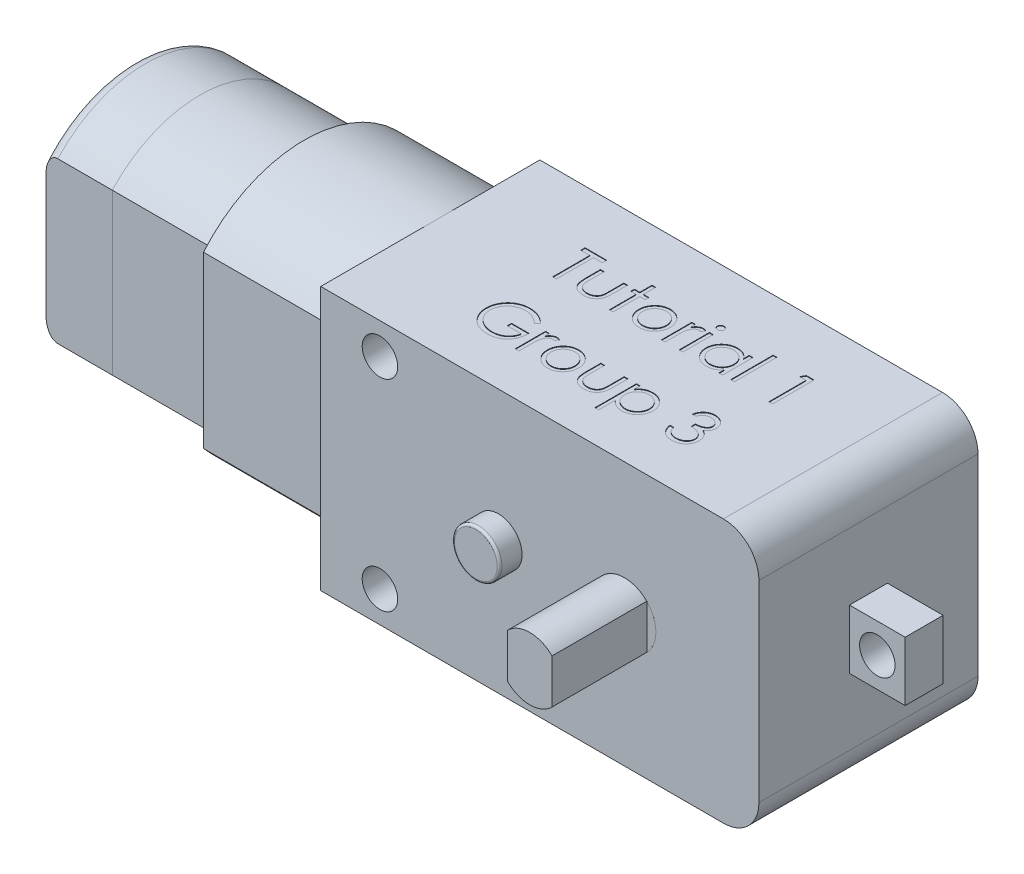
from build123d import *

# Parameters (mm, degrees)
BOSS_EXTRUDE1_DEPTH              = 9.25
BOSS_EXTRUDE1_DEPTH_BACK         = 9.25
BOSS_EXTRUDE2_DEPTH              = 11.4
SKETCH3_W                        = 3.2
SKETCH3_H                        = 5
BOSS_EXTRUDE3_DEPTH              = 4.7
CUT_EXTRUDE1_DEPTH               = 28
CUT_EXTRUDE1_DEPTH_BACK          = 17.7
SKETCH4_R                        = 1.5
SKETCH5_R                        = 2
BOSS_EXTRUDE4_DEPTH              = 1.9
FILLET1_R                        = 0.2
SKETCH6_R                        = 2.65
CUT_EXTRUDE2_DEPTH               = 23.9
BOSS_EXTRUDE5_DEPTH              = 8.8
BOSS_EXTRUDE6_DEPTH              = 5.6
FILLET2_R                        = 1
BOSS_EXTRUDE7_DEPTH              = 1
SKETCH12_R                       = 1
BOSS_EXTRUDE8_DEPTH              = 0.5
SKETCH14_R                       = 1.5
CUT_EXTRUDE3_DEPTH               = 4.2
BOSS_EXTRUDE10_DEPTH             = 17.25
BOSS_EXTRUDE10_DEPTH_BACK        = 17.25
BOSS_EXTRUDE11_REACH             = 52.189
SKETCH16_R                       = 2.65
BOSS_EXTRUDE11_DIRECTION_2_REACH = 52.189
SKETCH22_W                       = 0.314102564
SKETCH22_H                       = 2.557692307
SKETCH22_H_2                     = 3.589743589
CUT_EXTRUDE4_DEPTH               = 0.05


with BuildPart() as part:
    # Sketch 1 → Boss-Extrude1 (new, two sides: drawn at the far end of the back side and taken through both)
    with BuildSketch(Plane.XY.offset(-BOSS_EXTRUDE1_DEPTH_BACK)):
        with BuildLine():
            Line((-18.5, -11.125), (15.5, -11.125))
            ThreePointArc((15.5, -11.125), (17.621320344, -10.246320344), (18.5, -8.125))
            Line((18.5, -8.125), (18.5, 8.125))
            ThreePointArc((18.5, 8.125), (17.621320344, 10.246320344), (15.5, 11.125))
            Line((15.5, 11.125), (-18.5, 11.125))
            Line((-18.5, 11.125), (-18.5, -11.125))
        make_face()
    extrude(amount=BOSS_EXTRUDE1_DEPTH + BOSS_EXTRUDE1_DEPTH_BACK)

    # Sketch2 → Boss-Extrude2 (add)
    with BuildSketch(Plane.ZY.offset(18.5)):
        with BuildLine():
            Line((7.75, -7.17743861), (7.75, 7.17743861))
            ThreePointArc((7.75, 7.17743861), (-0.75, 11.125), (-9.25, 7.17743861))
            Line((-9.25, 7.17743861), (-9.25, -7.17743861))
            ThreePointArc((-9.25, -7.17743861), (-0.75, -11.125), (7.75, -7.17743861))
        make_face()
    extrude(amount=BOSS_EXTRUDE2_DEPTH)

    # Sketch3 → Boss-Extrude3 (add)
    with BuildSketch(Plane(origin=(18.5, 0, 0), x_dir=(0, 0, -1), z_dir=(1, 0, 0))):
        Rectangle(SKETCH3_W, SKETCH3_H)
    extrude(amount=BOSS_EXTRUDE3_DEPTH)

    # Sketch4 → Cut-Extrude1 (cut, two sides: drawn at the far end of the back side and taken through both)
    with BuildSketch(Plane.XY.offset(-CUT_EXTRUDE1_DEPTH_BACK)):
        with Locations((-13.5, 8.5)):
            Circle(SKETCH4_R)
        with Locations((-13.5, -8.5)):
            Circle(SKETCH4_R)
    extrude(amount=CUT_EXTRUDE1_DEPTH + CUT_EXTRUDE1_DEPTH_BACK, mode=Mode.SUBTRACT)

    # Sketch5 → Boss-Extrude4 (add)
    with BuildSketch(Plane.XY.offset(9.25)):
        with Locations((-3.5, 0)):
            Circle(SKETCH5_R)
    extrude(amount=BOSS_EXTRUDE4_DEPTH)

    # Fillet1
    fillet1_edges = [part.edges().sort_by_distance(p)[0] for p in [
        (-5.5, 0, 11.15),
    ]]
    fillet(fillet1_edges, radius=FILLET1_R)

    # Sketch6 → Cut-Extrude2 (cut)
    with BuildSketch(Plane.XY.offset(9.25)):
        with Locations((7.15, 0)):
            Circle(SKETCH6_R)
    extrude(amount=-CUT_EXTRUDE2_DEPTH, mode=Mode.SUBTRACT)

    # Sketch14 → Cut-Extrude3 (cut)
    with BuildSketch(Plane.XY.offset(1.6)):
        with Locations((20.85, 0)):
            Circle(SKETCH14_R)
    extrude(amount=-CUT_EXTRUDE3_DEPTH, mode=Mode.SUBTRACT)


with BuildPart() as body_2:
    # Sketch9 → Boss-Extrude5 (new body)
    with BuildSketch(Plane.ZY.offset(29.9)):
        with BuildLine():
            Line((6.65, -6.763181574), (6.65, 6.763181574))
            ThreePointArc((6.65, 6.763181574), (-0.75, 10.025), (-8.15, 6.763181574))
            Line((-8.15, 6.763181574), (-8.15, -6.763181574))
            ThreePointArc((-8.15, -6.763181574), (-0.75, -10.025), (6.65, -6.763181574))
        make_face()
    extrude(amount=BOSS_EXTRUDE5_DEPTH)


with BuildPart() as body_3:
    # Sketch10 → Boss-Extrude6 (new body)
    with BuildSketch(Plane.ZY.offset(38.7)):
        with BuildLine():
            Line((-8.15, 6.763181574), (-8.15, -6.763181574))
            ThreePointArc((-8.15, -6.763181574), (-0.75, -10.025), (6.65, -6.763181574))
            Line((6.65, -6.763181574), (6.65, 6.763181574))
            ThreePointArc((6.65, 6.763181574), (-0.75, 10.025), (-8.15, 6.763181574))
        make_face()
    extrude(amount=BOSS_EXTRUDE6_DEPTH)

    # Fillet2
    fillet2_edges = [body_3.edges().sort_by_distance(p)[0] for p in [
        (-44.3, 10.025, -0.75),
        (-44.3, -10.025, -0.75),
    ]]
    fillet(fillet2_edges, radius=FILLET2_R)


with BuildPart() as body_4:
    # Sketch11 → Boss-Extrude7 (new body)
    with BuildSketch(Plane.ZY.offset(44.3)):
        with BuildLine():
            Line((2.65, 3.666060556), (2.65, -3.666060556))
            ThreePointArc((2.65, -3.666060556), (-5.75, 0), (2.65, 3.666060556))
        make_face()
    extrude(amount=BOSS_EXTRUDE7_DEPTH)


with BuildPart() as body_5:
    # Sketch12 → Boss-Extrude8 (new body)
    with BuildSketch(Plane.ZY.offset(45.3)):
        with Locations((-0.75, 0)):
            Circle(SKETCH12_R)
    extrude(amount=BOSS_EXTRUDE8_DEPTH)


with BuildPart() as body_6:
    # Sketch15 → Boss-Extrude10 (new, two sides: drawn at the far end of the back side and taken through both)
    with BuildSketch(Plane.XY.offset(-BOSS_EXTRUDE10_DEPTH_BACK)):
        with BuildLine():
            Line((9.03, -1.867645577), (9.03, 1.867645577))
            ThreePointArc((9.03, 1.867645577), (7.15, 2.65), (5.27, 1.867645577))
            Line((5.27, 1.867645577), (5.27, -1.867645577))
            ThreePointArc((5.27, -1.867645577), (7.15, -2.65), (9.03, -1.867645577))
        make_face()
    extrude(amount=BOSS_EXTRUDE10_DEPTH + BOSS_EXTRUDE10_DEPTH_BACK)


with BuildPart() as body_7:

    # Boss-Extrude11: up to this face of the body (flat: up to its plane)
    boss_extrude11_end = Plane(part.part.faces().sort_by_distance((0.010664145, 0, 9.25))[0])
    # Sketch16 → Boss-Extrude11 (new, up to the picked face)
    with BuildSketch(Plane.XY, mode=Mode.PRIVATE) as boss_extrude11_sk1:
        with Locations((7.15, 0)):
            Circle(SKETCH16_R)
    boss_extrude11_tool1 = split(extrude(boss_extrude11_sk1.sketch, amount=BOSS_EXTRUDE11_REACH, mode=Mode.PRIVATE), bisect_by=boss_extrude11_end, keep=Keep.BOTH, mode=Mode.PRIVATE)
    add(boss_extrude11_tool1.solids().sort_by(Axis((7.15, 0, 0), (0, 0, 1)))[0])


    # Boss-Extrude11 direction 2: up to this face of the body (flat: up to its plane)
    boss_extrude11_direction_2_end = Plane(part.part.faces().sort_by_distance((-4.220368924, 0, -9.25))[0])
    # Sketch16 → Boss-Extrude11 direction 2 (add, up to the picked face)
    with BuildSketch(Plane.XY, mode=Mode.PRIVATE) as boss_extrude11_direction_2_sk1:
        with Locations((7.15, 0)):
            Circle(SKETCH16_R)
    boss_extrude11_direction_2_tool1 = split(extrude(boss_extrude11_direction_2_sk1.sketch, amount=-BOSS_EXTRUDE11_DIRECTION_2_REACH, mode=Mode.PRIVATE), bisect_by=boss_extrude11_direction_2_end, keep=Keep.BOTH, mode=Mode.PRIVATE)
    add(boss_extrude11_direction_2_tool1.solids().sort_by(Axis((7.15, 0, 0), (0, 0, -1)))[0])


with BuildPart() as part_1:
    add(part.part)

    # Sketch22 → Cut-Extrude4 (cut)
    # profile 1 of 16: a face of its own
    with BuildSketch(Plane(origin=(0, 11.125, 0), x_dir=(1, 0, 0), z_dir=(0, 1, 0))):
        Polygon((-10.170684776, 4.378275517), (-10.170684776, 4.737249876), (-8.330941186, 4.737249876), (-8.330941186, 4.378275517), (-9.093761699, 4.378275517), (-9.093761699, 1.237249876), (-9.407864263, 1.237249876), (-9.407864263, 4.378275517), align=None)
    # profile 2 of 16: a face of its own
    with BuildSketch(Plane(origin=(0, 11.125, 0), x_dir=(1, 0, 0), z_dir=(0, 1, 0))):
        with BuildLine():
            Line((-7.927095033, 3.794942183), (-7.612992469, 3.794942183))
            Line((-7.612992469, 3.794942183), (-7.612992469, 2.608644106))
            add(Edge.make_bspline(
                [(-7.612992469, 2.608644106), (-7.612850564, 2.573821357), (-7.612579106, 2.507207069), (-7.610738165, 2.411351882), (-7.606408072, 2.32393517), (-7.600994247, 2.244906433), (-7.594032111, 2.174279041), (-7.58574875, 2.112299684), (-7.576490329, 2.0582655), (-7.567427615, 2.025722145), (-7.563212821, 2.010587215)],
                knots=[0, 0, 0, 0, 1.388932606, 2.656963016, 3.823490214, 4.879454478, 5.816252168, 6.653371382, 7.373723809, 8, 8, 8, 8], degree=3))
            add(Edge.make_bspline(
                [(-7.563212821, 2.010587215), (-7.556451366, 1.991564344), (-7.543069025, 1.953914083), (-7.518795541, 1.899525078), (-7.488767205, 1.849149796), (-7.455907377, 1.800845723), (-7.418007969, 1.756043736), (-7.375548498, 1.714819492), (-7.329950261, 1.675615401), (-7.262195238, 1.629230609), (-7.169535972, 1.579515279), (-7.047883216, 1.536619461), (-6.915978991, 1.510983641), (-6.824814271, 1.508009386), (-6.777956411, 1.506480645)],
                knots=[0, 0, 0, 0, 0.725840625, 1.436591201, 2.137033971, 2.831655856, 3.53531722, 4.242432219, 4.957935707, 5.694543706, 7.190802206, 8.724350549, 10.316345118, 12, 12, 12, 12], degree=3))
            add(Edge.make_bspline(
                [(-6.777956411, 1.506480645), (-6.731102903, 1.508041893), (-6.640450035, 1.511062621), (-6.509995066, 1.535846159), (-6.390743651, 1.577251848), (-6.2838927, 1.63505926), (-6.18992686, 1.705801323), (-6.111622441, 1.788810132), (-6.047015186, 1.881459518), (-6.018805766, 1.950583797), (-6.004619071, 1.985346831)],
                knots=[0, 0, 0, 0, 1.157059328, 2.238695713, 3.266970494, 4.264342957, 5.228770407, 6.160125903, 7.074715775, 8, 8, 8, 8], degree=3))
            add(Edge.make_bspline(
                [(-6.004619071, 1.985346831), (-6.000424841, 1.999313129), (-5.991152423, 2.030189205), (-5.981190071, 2.082568953), (-5.97221561, 2.145033558), (-5.964552433, 2.217991766), (-5.959087271, 2.301252919), (-5.956141244, 2.394790995), (-5.952812969, 2.498312355), (-5.952762453, 2.570780114), (-5.952736058, 2.608644106)],
                knots=[0, 0, 0, 0, 0.557542046, 1.232589297, 2.036731608, 2.971723315, 4.038036528, 5.22795436, 6.551621927, 8, 8, 8, 8], degree=3))
            Line((-5.952736058, 2.608644106), (-5.952736058, 3.794942183))
            Line((-5.952736058, 3.794942183), (-5.638633494, 3.794942183))
            Line((-5.638633494, 3.794942183), (-5.638633494, 2.549749876))
            add(Edge.make_bspline(
                [(-5.638633494, 2.549749876), (-5.639075189, 2.507442704), (-5.639932137, 2.425361004), (-5.645439481, 2.306076893), (-5.654889093, 2.194914648), (-5.669231778, 2.091815428), (-5.686097453, 1.996857946), (-5.707853726, 1.9099205), (-5.733831964, 1.831270946), (-5.763137479, 1.759529169), (-5.797759346, 1.694482275), (-5.834586367, 1.632746459), (-5.877111139, 1.575853523), (-5.921881373, 1.520971386), (-5.971683029, 1.470829859), (-6.025582888, 1.424278383), (-6.082822308, 1.380605351), (-6.144671506, 1.341514072), (-6.210227568, 1.306297426), (-6.279571426, 1.275081348), (-6.353552424, 1.250378771), (-6.431216061, 1.229068106), (-6.51294284, 1.212353636), (-6.598653973, 1.20056707), (-6.688320589, 1.193341739), (-6.749430049, 1.192704694), (-6.780760898, 1.192378081)],
                knots=[0, 0, 0, 0, 1.493040784, 2.896703357, 4.213163133, 5.428574705, 6.569057535, 7.615249723, 8.588095153, 9.490268104, 10.346124644, 11.18633936, 12.024365274, 12.850166724, 13.684164916, 14.514361689, 15.362232829, 16.222528818, 17.093394965, 17.986930858, 18.902426812, 19.842810585, 20.827885679, 21.843828298, 22.894529745, 24, 24, 24, 24], degree=3))
            add(Edge.make_bspline(
                [(-6.780760898, 1.192378081), (-6.811857412, 1.192717788), (-6.872964957, 1.193385344), (-6.962636201, 1.200527152), (-7.048584808, 1.212335322), (-7.130505206, 1.22919054), (-7.208479604, 1.25022961), (-7.282823843, 1.275233145), (-7.352667406, 1.306313627), (-7.41884941, 1.341291184), (-7.480851799, 1.38085646), (-7.538960377, 1.424224499), (-7.593097229, 1.471330562), (-7.643274297, 1.52197792), (-7.688787274, 1.576794856), (-7.730203316, 1.635340416), (-7.768160021, 1.697034505), (-7.802512811, 1.763097667), (-7.832024567, 1.835669677), (-7.858079813, 1.915966774), (-7.879390451, 2.004869291), (-7.896732919, 2.102301219), (-7.91068436, 2.207796261), (-7.920370502, 2.321964676), (-7.925786333, 2.444528368), (-7.926649394, 2.529178259), (-7.927095033, 2.572886895)],
                knots=[0, 0, 0, 0, 1.083640291, 2.129454052, 3.13281866, 4.105697902, 5.042300162, 5.946461698, 6.836384745, 7.703652036, 8.553297018, 9.397182691, 10.228592656, 11.052265423, 11.879314572, 12.708807002, 13.549817954, 14.402308542, 15.300838682, 16.27712199, 17.341985831, 18.484375296, 19.725102775, 21.0496083, 22.476576903, 24, 24, 24, 24], degree=3))
            Line((-7.927095033, 2.572886895), (-7.927095033, 3.794942183))
        make_face()
    # profile 3 of 16: a face of its own
    with BuildSketch(Plane(origin=(0, 11.125, 0), x_dir=(1, 0, 0), z_dir=(0, 1, 0))):
        Polygon((-4.606582212, 4.826993465), (-4.292479648, 4.826993465), (-4.292479648, 3.794942183), (-3.843761699, 3.794942183), (-3.843761699, 3.480839619), (-4.292479648, 3.480839619), (-4.292479648, 1.237249876), (-4.606582212, 1.237249876), (-4.606582212, 3.480839619), (-5.055300161, 3.480839619), (-5.055300161, 3.794942183), (-4.606582212, 3.794942183), align=None)
    # profile 4 of 16: a face of its own
    with BuildSketch(Plane(origin=(0, 11.125, 0), x_dir=(1, 0, 0), z_dir=(0, 1, 0))):
        with BuildLine():
            add(Edge.make_bspline(
                [(-2.069923558, 3.839813978), (-2.021932285, 3.838792087), (-1.927833128, 3.836788408), (-1.790025242, 3.815373443), (-1.658480106, 3.782626078), (-1.532693914, 3.737354516), (-1.414277618, 3.676672566), (-1.301506374, 3.604263274), (-1.194689365, 3.518480681), (-1.130666336, 3.452122612), (-1.098168751, 3.418439779)],
                knots=[0, 0, 0, 0, 1.054011418, 2.066658804, 3.057071809, 4.030435133, 4.997543892, 5.974964718, 6.972108034, 8, 8, 8, 8], degree=3))
            add(Edge.make_bspline(
                [(-1.098168751, 3.418439779), (-1.070186797, 3.386225794), (-1.014764416, 3.322421251), (-0.943698697, 3.218965638), (-0.882477137, 3.111825538), (-0.833414176, 2.999578211), (-0.794729153, 2.88320354), (-0.767263456, 2.762301529), (-0.750926521, 2.637139182), (-0.748723555, 2.552135344), (-0.747607853, 2.509084811)],
                knots=[0, 0, 0, 0, 1.025258237, 2.030674902, 3.01204498, 3.988269485, 4.97094183, 5.956517959, 6.965070386, 8, 8, 8, 8], degree=3))
            add(Edge.make_bspline(
                [(-0.747607853, 2.509084811), (-0.74858919, 2.465784754), (-0.750528359, 2.38022182), (-0.768871975, 2.254202455), (-0.797403061, 2.132007632), (-0.838234899, 2.014148938), (-0.890593008, 1.900266111), (-0.954483696, 1.790856562), (-1.030355313, 1.685704428), (-1.11635931, 1.58570259), (-1.211411186, 1.493536375), (-1.314527334, 1.413208106), (-1.423681368, 1.344386581), (-1.540324721, 1.288950166), (-1.663392208, 1.245240465), (-1.793149276, 1.214540449), (-1.929394347, 1.195978765), (-2.022421568, 1.193595192), (-2.069923558, 1.192378081)],
                knots=[0, 0, 0, 0, 0.998656419, 1.973391657, 2.932242238, 3.890759089, 4.846373663, 5.82037756, 6.809684879, 7.83454468, 8.860553229, 9.859544525, 10.845671541, 11.83227036, 12.833544569, 13.85385346, 14.904124723, 16, 16, 16, 16], degree=3))
            add(Edge.make_bspline(
                [(-2.069923558, 1.192378081), (-2.117658278, 1.193599277), (-2.211149137, 1.195991051), (-2.347875119, 1.214468334), (-2.477864738, 1.245226317), (-2.601093337, 1.289093809), (-2.718238184, 1.344388353), (-2.828024681, 1.413000043), (-2.931224596, 1.493560198), (-3.026296581, 1.585696135), (-3.112295186, 1.685706091), (-3.188168194, 1.79085613), (-3.252058521, 1.900266223), (-3.304416724, 2.014148908), (-3.345248537, 2.13200764), (-3.37377963, 2.254202452), (-3.392123245, 2.380221821), (-3.394062413, 2.465784754), (-3.395043751, 2.509084811)],
                knots=[0, 0, 0, 0, 1.099876186, 2.154163076, 3.173186993, 4.173200201, 5.163417411, 6.152872554, 7.150605724, 8.17532212, 9.198891216, 10.186952605, 11.159729845, 12.11414092, 13.071450619, 14.029093627, 15.002601286, 16, 16, 16, 16], degree=3))
            add(Edge.make_bspline(
                [(-3.395043751, 2.509084811), (-3.39392044, 2.551901357), (-3.391696479, 2.63667076), (-3.37537597, 2.76159782), (-3.348017413, 2.882295209), (-3.309286017, 2.998220685), (-3.259770826, 3.109976122), (-3.199409538, 3.217380952), (-3.127618905, 3.320368753), (-3.072416954, 3.384090833), (-3.044482853, 3.416336414)],
                knots=[0, 0, 0, 0, 1.031353054, 2.041901799, 3.029428768, 4.008703097, 4.981709435, 5.96992636, 6.972712378, 8, 8, 8, 8], degree=3))
            add(Edge.make_bspline(
                [(-3.044482853, 3.416336414), (-3.012034262, 3.450311353), (-2.948218398, 3.517129049), (-2.840869671, 3.602661574), (-2.728375849, 3.676577647), (-2.608650923, 3.736053863), (-2.482968065, 3.782892381), (-2.350748823, 3.815457896), (-2.212473307, 3.836711251), (-2.117913686, 3.838769429), (-2.069923558, 3.839813978)],
                knots=[0, 0, 0, 0, 1.027980169, 2.021703884, 2.998553061, 3.971491411, 4.943284454, 5.930300938, 6.949603206, 8, 8, 8, 8], degree=3))
        make_face()
        with BuildLine():
            add(Edge.make_bspline(
                [(-2.071325802, 3.525711414), (-2.105263413, 3.524746822), (-2.172262542, 3.52284254), (-2.270882127, 3.508358635), (-2.36582228, 3.485411131), (-2.457263125, 3.452807075), (-2.544896297, 3.410708176), (-2.628805699, 3.358999816), (-2.709238139, 3.298366859), (-2.784620203, 3.228904188), (-2.853802515, 3.153025193), (-2.914280491, 3.072176834), (-2.965705598, 2.987670488), (-3.008545757, 2.899418277), (-3.040452945, 2.806525863), (-3.063625967, 2.710045232), (-3.078096208, 2.609779815), (-3.079982586, 2.541618797), (-3.080941186, 2.506981446)],
                knots=[0, 0, 0, 0, 1.021534396, 2.016698045, 2.994645724, 3.958388632, 4.93408049, 5.916473867, 6.921342795, 7.962252576, 8.998418191, 10.008913653, 10.997312074, 11.973003931, 12.956656626, 13.948281152, 14.957379055, 16, 16, 16, 16], degree=3))
            add(Edge.make_bspline(
                [(-3.080941186, 2.506981446), (-3.079334363, 2.462229419), (-3.076145118, 2.373405013), (-3.050209882, 2.242593891), (-3.006823602, 2.117012039), (-2.948236322, 1.997395653), (-2.874830104, 1.886723375), (-2.788343037, 1.78805189), (-2.689703337, 1.702866079), (-2.580086836, 1.632185233), (-2.461732519, 1.576025478), (-2.336476197, 1.536226502), (-2.205835503, 1.510354809), (-2.116554772, 1.507783335), (-2.071325802, 1.506480645)],
                knots=[0, 0, 0, 0, 1.016792936, 2.018143844, 3.017858371, 4.030088057, 5.03801393, 6.028138512, 7.003788237, 7.991172063, 8.984598303, 9.972568034, 10.972917682, 12, 12, 12, 12], degree=3))
            add(Edge.make_bspline(
                [(-2.071325802, 1.506480645), (-2.026099433, 1.507790925), (-1.936823837, 1.510377382), (-1.80636466, 1.536096202), (-1.681450688, 1.576199862), (-1.563219301, 1.632122072), (-1.453652697, 1.703134487), (-1.354303576, 1.787570864), (-1.268554965, 1.886984715), (-1.19522136, 1.997542244), (-1.135674617, 2.116826596), (-1.092491415, 2.242617069), (-1.06649383, 2.373399111), (-1.063313001, 2.462227441), (-1.061710417, 2.506981446)],
                knots=[0, 0, 0, 0, 1.02726834, 2.027799167, 3.010890988, 4.004497153, 4.992059811, 5.971914811, 6.958719428, 7.966827853, 8.981595046, 9.981490638, 10.983022906, 12, 12, 12, 12], degree=3))
            add(Edge.make_bspline(
                [(-1.061710417, 2.506981446), (-1.062668687, 2.541619004), (-1.064554416, 2.609780429), (-1.079029381, 2.710042883), (-1.10218492, 2.80653448), (-1.134156538, 2.899386483), (-1.176810552, 2.987898987), (-1.229227345, 3.071928714), (-1.28945837, 3.15330526), (-1.359475491, 3.228658901), (-1.434778869, 3.298393938), (-1.515243907, 3.359023327), (-1.599028886, 3.410480923), (-1.686407468, 3.453167163), (-1.777860036, 3.485114504), (-1.872667165, 3.508491135), (-1.970865975, 3.522781332), (-2.037625018, 3.524728473), (-2.071325802, 3.525711414)],
                knots=[0, 0, 0, 0, 1.042956736, 2.052379634, 3.044323526, 4.02829302, 5.004299113, 5.996692471, 7.007513377, 8.048758398, 9.090003419, 10.095195979, 11.07790575, 12.047570684, 13.018257071, 13.989683339, 14.985167495, 16, 16, 16, 16], degree=3))
        make_face(mode=Mode.SUBTRACT)
    # profile 5 of 16: a face of its own
    with BuildSketch(Plane(origin=(0, 11.125, 0), x_dir=(1, 0, 0), z_dir=(0, 1, 0))):
        with BuildLine():
            Line((-0.209146315, 3.794942183), (0.104956249, 3.794942183))
            Line((0.104956249, 3.794942183), (0.104956249, 3.418439779))
            add(Edge.make_bspline(
                [(0.104956249, 3.418439779), (0.128145008, 3.453495608), (0.172493329, 3.520539607), (0.246206258, 3.609208908), (0.32170959, 3.682623955), (0.399364777, 3.741127473), (0.479742877, 3.784940592), (0.561079829, 3.817033627), (0.644655299, 3.836010942), (0.700817223, 3.838544601), (0.728954647, 3.839813978)],
                knots=[0, 0, 0, 0, 1.2804753, 2.448899062, 3.506932113, 4.484331642, 5.4025378, 6.288909075, 7.142734305, 8, 8, 8, 8], degree=3))
            add(Edge.make_bspline(
                [(0.728954647, 3.839813978), (0.750780973, 3.838623452), (0.795690059, 3.836173866), (0.863672648, 3.818963041), (0.9337161, 3.791485018), (0.978858488, 3.765644796), (1.002392147, 3.752173754)],
                knots=[0, 0, 0, 0, 0.901110191, 1.854092781, 2.881294221, 4, 4, 4, 4], degree=3))
            Line((1.002392147, 3.752173754), (0.829916185, 3.480138497))
            add(Edge.make_bspline(
                [(0.829916185, 3.480138497), (0.814807164, 3.486878763), (0.78612735, 3.499673079), (0.744172783, 3.514815089), (0.705491447, 3.523731005), (0.680847888, 3.525081722), (0.669359294, 3.525711414)],
                knots=[0, 0, 0, 0, 1.180555205, 2.24091978, 3.179933427, 4, 4, 4, 4], degree=3))
            add(Edge.make_bspline(
                [(0.669359294, 3.525711414), (0.644153561, 3.524031377), (0.592741171, 3.520604587), (0.517256671, 3.49366578), (0.444009466, 3.45014054), (0.385837804, 3.401869428), (0.340795551, 3.35532163), (0.308655325, 3.314673228), (0.279172578, 3.269094596), (0.251002358, 3.219364912), (0.225336064, 3.164635066), (0.201381394, 3.105451853), (0.179722531, 3.041746724), (0.167372287, 2.997364204), (0.161045993, 2.974629683)],
                knots=[0, 0, 0, 0, 1.125678352, 2.296057538, 3.5422874, 4.923748041, 5.663163013, 6.437101912, 7.23742474, 8.08941207, 8.991984279, 9.93940061, 10.944477711, 12, 12, 12, 12], degree=3))
            add(Edge.make_bspline(
                [(0.161045993, 2.974629683), (0.1563136, 2.95435251), (0.145831708, 2.909440111), (0.13564017, 2.834091586), (0.125570652, 2.745067928), (0.118474034, 2.642121335), (0.111895992, 2.525508891), (0.108185909, 2.395052945), (0.105082769, 2.250619594), (0.104999702, 2.149645241), (0.104956249, 2.096825196)],
                knots=[0, 0, 0, 0, 0.566838948, 1.255505196, 2.06880316, 3.007127437, 4.065329342, 5.249902469, 6.561414163, 8, 8, 8, 8], degree=3))
            Line((0.104956249, 2.096825196), (0.104956249, 1.237249876))
            Line((0.104956249, 1.237249876), (-0.209146315, 1.237249876))
            Line((-0.209146315, 1.237249876), (-0.209146315, 3.794942183))
        make_face()
    # profile 6 of 16: a face of its own
    with BuildSketch(Plane(origin=(0, 11.125, 0), x_dir=(1, 0, 0), z_dir=(0, 1, 0))):
        with BuildLine():
            add(Edge.make_bspline(
                [(1.427271955, 4.87186526), (1.44676327, 4.870961108), (1.48493101, 4.869190604), (1.540124278, 4.854029127), (1.59038129, 4.828329441), (1.634959023, 4.79384976), (1.67321091, 4.753300317), (1.69999162, 4.706039349), (1.717204016, 4.65498071), (1.719282571, 4.619365621), (1.720340865, 4.601232247)],
                knots=[0, 0, 0, 0, 1.055194115, 2.066272739, 3.074728998, 4.095836921, 5.109056067, 6.073838105, 7.019297344, 8, 8, 8, 8], degree=3))
            add(Edge.make_bspline(
                [(1.720340865, 4.601232247), (1.719258705, 4.583569594), (1.717119403, 4.548652619), (1.700004915, 4.498479147), (1.672982677, 4.451874864), (1.634983551, 4.411404153), (1.59037479, 4.376943533), (1.540126005, 4.351238795), (1.484930556, 4.336078657), (1.446763117, 4.334307968), (1.427271955, 4.333403722)],
                knots=[0, 0, 0, 0, 0.96129708, 1.900370562, 2.859976407, 3.87933698, 4.906634145, 5.921202961, 6.938410037, 8, 8, 8, 8], degree=3))
            add(Edge.make_bspline(
                [(1.427271955, 4.333403722), (1.408003679, 4.334273442), (1.370500499, 4.335966239), (1.316133657, 4.351536256), (1.266305167, 4.37695233), (1.221640495, 4.411178515), (1.184410302, 4.452123412), (1.157311976, 4.498450706), (1.140237014, 4.54865986), (1.138092386, 4.583572027), (1.137007531, 4.601232247)],
                knots=[0, 0, 0, 0, 1.054934014, 2.053291228, 3.073705704, 4.106921865, 5.123545215, 6.088680038, 7.033164197, 8, 8, 8, 8], degree=3))
            add(Edge.make_bspline(
                [(1.137007531, 4.601232247), (1.138068618, 4.619363097), (1.140152659, 4.65497323), (1.157324775, 4.706068262), (1.184184583, 4.753049764), (1.221665147, 4.794075264), (1.266298607, 4.828320698), (1.316135352, 4.85373168), (1.370500051, 4.869303019), (1.408003527, 4.870995634), (1.427271955, 4.87186526)],
                knots=[0, 0, 0, 0, 0.98631895, 1.937192651, 2.907499808, 3.917963147, 4.944918757, 5.95915025, 6.951458133, 8, 8, 8, 8], degree=3))
        make_face()
    # profile 7 of 16: a face of its own
    with BuildSketch(Plane(origin=(0, 11.125, 0), x_dir=(1, 0, 0), z_dir=(0, 1, 0))):
        with Locations((1.428674198, 2.51609603)):
            Rectangle(SKETCH22_W, SKETCH22_H)
    # profile 8 of 16: a face of its own
    with BuildSketch(Plane(origin=(0, 11.125, 0), x_dir=(1, 0, 0), z_dir=(0, 1, 0))):
        with BuildLine():
            Line((4.951110096, 3.794942183), (4.951110096, 1.237249876))
            Line((4.951110096, 1.237249876), (4.637007531, 1.237249876))
            Line((4.637007531, 1.237249876), (4.637007531, 1.679657728))
            add(Edge.make_bspline(
                [(4.637007531, 1.679657728), (4.601588741, 1.639618134), (4.532468526, 1.561480363), (4.417027408, 1.459398191), (4.29465923, 1.375019869), (4.165957909, 1.306869953), (4.031039665, 1.255677897), (3.890203578, 1.219291738), (3.743392197, 1.195897903), (3.643139842, 1.193561881), (3.592336057, 1.192378081)],
                knots=[0, 0, 0, 0, 1.074387032, 2.096679803, 3.090159297, 4.057316773, 5.018401886, 5.985159533, 6.978961417, 8, 8, 8, 8], degree=3))
            add(Edge.make_bspline(
                [(3.592336057, 1.192378081), (3.547168103, 1.193604453), (3.458094898, 1.196022913), (3.327065821, 1.214785217), (3.200973572, 1.244915839), (3.079698999, 1.286816728), (2.964026854, 1.34239755), (2.852966757, 1.408938798), (2.747094065, 1.488179628), (2.648022526, 1.578767656), (2.556790526, 1.677162643), (2.476729253, 1.78210819), (2.409976173, 1.893150494), (2.354156092, 2.008883648), (2.311159748, 2.130198568), (2.281186114, 2.256675736), (2.262445667, 2.388165609), (2.260028206, 2.477705132), (2.258802403, 2.523107247)],
                knots=[0, 0, 0, 0, 1.033919861, 2.038935746, 3.024066025, 3.998881131, 4.97069526, 5.957263378, 6.95902576, 7.993208707, 9.027059324, 10.027763471, 11.009749337, 11.988697705, 12.965288445, 13.950418724, 14.960734635, 16, 16, 16, 16], degree=3))
            add(Edge.make_bspline(
                [(2.258802403, 2.523107247), (2.260055375, 2.567570951), (2.262532431, 2.655473294), (2.280985651, 2.784751992), (2.31201666, 2.909270253), (2.355564508, 3.028627196), (2.411406463, 3.142967246), (2.47933455, 3.252371271), (2.559353674, 3.357140669), (2.651606081, 3.454811896), (2.751540852, 3.54503251), (2.858449582, 3.623441555), (2.969672864, 3.691158404), (3.086935874, 3.74481188), (3.208502979, 3.788220985), (3.335456425, 3.818253953), (3.467268004, 3.835951274), (3.556758496, 3.838514039), (3.602151762, 3.839813978)],
                knots=[0, 0, 0, 0, 1.020392517, 2.01726096, 2.990465484, 3.961182959, 4.928053699, 5.906110375, 6.912531644, 7.948652711, 8.985773172, 9.998621852, 10.987621588, 11.969261332, 12.953316658, 13.946091881, 14.958173133, 16, 16, 16, 16], degree=3))
            add(Edge.make_bspline(
                [(3.602151762, 3.839813978), (3.654351621, 3.838376227), (3.756713081, 3.835556864), (3.906441091, 3.812094136), (4.048085568, 3.772455669), (4.18273992, 3.718538171), (4.309920607, 3.646889442), (4.428423591, 3.556509481), (4.539489074, 3.447968294), (4.603869366, 3.36459785), (4.637007531, 3.321684972)],
                knots=[0, 0, 0, 0, 1.038897134, 2.037228247, 3.008116434, 3.962042015, 4.918381754, 5.904844433, 6.921570401, 8, 8, 8, 8], degree=3))
            Line((4.637007531, 3.321684972), (4.637007531, 3.794942183))
            Line((4.637007531, 3.794942183), (4.951110096, 3.794942183))
        make_face()
        with BuildLine():
            add(Edge.make_bspline(
                [(3.606358493, 3.525711414), (3.560444155, 3.524077776), (3.469816555, 3.520853235), (3.336772553, 3.49567974), (3.209459139, 3.453795146), (3.088513065, 3.396513245), (2.975844848, 3.324484508), (2.875151177, 3.237363125), (2.785608476, 3.13752611), (2.710300212, 3.025424), (2.648909715, 2.905245909), (2.605742683, 2.779621471), (2.577273435, 2.650816493), (2.574364915, 2.563453808), (2.572904967, 2.519601638)],
                knots=[0, 0, 0, 0, 1.031046209, 2.035121221, 3.029706178, 4.034933723, 5.034054252, 6.02443088, 7.017295772, 8.038157696, 9.050218397, 10.03989886, 11.016116709, 12, 12, 12, 12], degree=3))
            add(Edge.make_bspline(
                [(2.572904967, 2.519601638), (2.574769861, 2.476011531), (2.578492338, 2.389002175), (2.605243032, 2.260021599), (2.650122905, 2.134367557), (2.711364968, 2.013106563), (2.788051593, 1.900522463), (2.876940245, 1.79878234), (2.978890527, 1.711292752), (3.091818034, 1.638055178), (3.212426004, 1.578892657), (3.339259936, 1.537727018), (3.469935574, 1.511149237), (3.558787908, 1.50804476), (3.603554006, 1.506480645)],
                knots=[0, 0, 0, 0, 0.979072187, 1.954306742, 2.945804271, 3.96968567, 4.997920485, 5.998718438, 6.996577872, 8.005894225, 9.015743152, 10.005417472, 10.995077863, 12, 12, 12, 12], degree=3))
            add(Edge.make_bspline(
                [(3.603554006, 1.506480645), (3.649000509, 1.508140609), (3.739389095, 1.511442112), (3.872827803, 1.536723378), (4.002322766, 1.578492176), (4.126109994, 1.636391303), (4.241426125, 1.708148659), (4.344924003, 1.79215575), (4.432439971, 1.889858934), (4.506632581, 1.997235387), (4.564807998, 2.114947383), (4.607184057, 2.240281574), (4.632237963, 2.373242322), (4.635395692, 2.464106249), (4.637007531, 2.510487055)],
                knots=[0, 0, 0, 0, 1.01762866, 2.023962475, 3.030623092, 4.058876274, 5.077231937, 6.066672613, 7.034107872, 8.005628644, 8.981990164, 9.965428785, 10.961468474, 12, 12, 12, 12], degree=3))
            add(Edge.make_bspline(
                [(4.637007531, 2.510487055), (4.636047875, 2.545824886), (4.634158968, 2.615380919), (4.619728398, 2.717508436), (4.596773472, 2.815242163), (4.564427302, 2.908684852), (4.521936017, 2.997319867), (4.470688251, 3.081783627), (4.409782802, 3.161636839), (4.340200106, 3.23577991), (4.264034903, 3.303406372), (4.183440362, 3.363770613), (4.097461615, 3.413359385), (4.007544579, 3.454400657), (3.913533244, 3.487059807), (3.814662624, 3.5088475), (3.711983637, 3.523807821), (3.641937582, 3.525070202), (3.606358493, 3.525711414)],
                knots=[0, 0, 0, 0, 1.050140795, 2.067009409, 3.05949893, 4.030605086, 5.00011959, 5.97591094, 6.962425594, 7.979863591, 8.993523472, 9.986985069, 10.967611495, 11.937549037, 12.921786183, 13.919465291, 14.943216303, 16, 16, 16, 16], degree=3))
        make_face(mode=Mode.SUBTRACT)
    # profile 9 of 16: a face of its own
    with BuildSketch(Plane(origin=(0, 11.125, 0), x_dir=(1, 0, 0), z_dir=(0, 1, 0))):
        with Locations((5.781238301, 3.032121671)):
            Rectangle(SKETCH22_W, SKETCH22_H_2)
    # profile 10 of 16: a face of its own
    with BuildSketch(Plane(origin=(0, 11.125, 0), x_dir=(1, 0, 0), z_dir=(0, 1, 0))):
        Polygon((8.521923397, 4.737249876), (9.169058814, 4.737249876), (9.169058814, 1.237249876), (8.854956249, 1.237249876), (8.854956249, 4.378275517), (8.316494711, 4.378275517), align=None)
    # profile 11 of 16: a face of its own
    with BuildSketch(Plane(origin=(0, 11.125, 0), x_dir=(1, 0, 0), z_dir=(0, 1, 0))):
        with BuildLine():
            Line((-6.491197597, -2.693439227), (-6.760428366, -2.94864756))
            add(Edge.make_bspline(
                [(-6.760428366, -2.94864756), (-6.809147254, -2.902816697), (-6.905423301, -2.812247834), (-7.062383543, -2.694736839), (-7.226147177, -2.594070739), (-7.395859674, -2.512164503), (-7.567318228, -2.446811742), (-7.738247004, -2.400283602), (-7.906892706, -2.370611064), (-8.019059924, -2.367062695), (-8.07433061, -2.365314227)],
                knots=[0, 0, 0, 0, 1.08915593, 2.152340314, 3.188132944, 4.216796309, 5.218260357, 6.173443236, 7.099959455, 8, 8, 8, 8], degree=3))
            add(Edge.make_bspline(
                [(-8.07433061, -2.365314227), (-8.108245309, -2.365727833), (-8.17598675, -2.366553972), (-8.276608694, -2.377098187), (-8.376175331, -2.392263051), (-8.474498706, -2.414204929), (-8.571769992, -2.442013988), (-8.667650884, -2.476799452), (-8.762320239, -2.517354696), (-8.85488632, -2.56421717), (-8.944626824, -2.615697016), (-9.029383659, -2.672745557), (-9.109697058, -2.733534347), (-9.184057484, -2.799585326), (-9.25289267, -2.870300191), (-9.317841042, -2.944363498), (-9.376618338, -3.023798716), (-9.429709503, -3.107144342), (-9.477071122, -3.192936531), (-9.518879775, -3.280349521), (-9.553976863, -3.369093375), (-9.581746318, -3.459279453), (-9.604656972, -3.550210043), (-9.62077458, -3.642514764), (-9.629861302, -3.736292449), (-9.631433082, -3.799089707), (-9.632223238, -3.830658778)],
                knots=[0, 0, 0, 0, 1.02818874, 2.053710826, 3.065248034, 4.081641283, 5.106893873, 6.131558223, 7.173050175, 8.228653731, 9.27666206, 10.308777013, 11.325269123, 12.329503258, 13.32196095, 14.316845687, 15.314881793, 16.315733098, 17.311955233, 18.285320748, 19.252783886, 20.203351036, 21.145449891, 22.095197417, 23.042428769, 24, 24, 24, 24], degree=3))
            add(Edge.make_bspline(
                [(-9.632223238, -3.830658778), (-9.631467519, -3.862929596), (-9.629958147, -3.927383109), (-9.620297827, -4.023577182), (-9.602369587, -4.118342584), (-9.578401878, -4.211990717), (-9.548421062, -4.304681965), (-9.511048396, -4.396014475), (-9.466782795, -4.485984866), (-9.415546243, -4.573782483), (-9.35936004, -4.659305506), (-9.296416959, -4.739865028), (-9.229556375, -4.816533805), (-9.156342476, -4.887609569), (-9.079122933, -4.954993466), (-8.995590657, -5.016828987), (-8.907388197, -5.074307211), (-8.814380985, -5.12670373), (-8.717578203, -5.173512266), (-8.61832145, -5.215136162), (-8.516293634, -5.249415499), (-8.412030944, -5.277353603), (-8.305657673, -5.3002539), (-8.19663387, -5.314986381), (-8.085761161, -5.325677212), (-8.011022529, -5.326458882), (-7.973369071, -5.326852689)],
                knots=[0, 0, 0, 0, 0.93586088, 1.869166235, 2.799637598, 3.729985548, 4.670839027, 5.622275134, 6.589130586, 7.576015415, 8.568469353, 9.55398029, 10.53834874, 11.515998671, 12.510579167, 13.508179873, 14.527009472, 15.561807829, 16.601455013, 17.643573243, 18.680854198, 19.719860599, 20.772568776, 21.833555941, 22.908541556, 24, 24, 24, 24], degree=3))
            add(Edge.make_bspline(
                [(-7.973369071, -5.326852689), (-7.927990724, -5.325904112), (-7.838882967, -5.324041429), (-7.707896524, -5.309541139), (-7.582093453, -5.286894345), (-7.46182725, -5.253728449), (-7.346958229, -5.211424774), (-7.237065288, -5.160429387), (-7.133013629, -5.098786328), (-7.034490456, -5.029212461), (-6.94373327, -4.951697629), (-6.861879146, -4.868053174), (-6.790233657, -4.778685107), (-6.727728958, -4.684119792), (-6.676020303, -4.583574487), (-6.633577508, -4.477541924), (-6.601044217, -4.365974412), (-6.587689242, -4.28888278), (-6.580941186, -4.249929612)],
                knots=[0, 0, 0, 0, 1.13008108, 2.219097802, 3.278683437, 4.311054135, 5.322181354, 6.324827112, 7.324222904, 8.330512327, 9.32562643, 10.293043162, 11.24128371, 12.174520618, 13.111833804, 14.052305215, 15.015860969, 16, 16, 16, 16], degree=3))
            Line((-6.580941186, -4.249929612), (-7.747607853, -4.249929612))
            Line((-7.747607853, -4.249929612), (-7.747607853, -3.890955253))
            Line((-7.747607853, -3.890955253), (-6.266838622, -3.890955253))
            add(Edge.make_bspline(
                [(-6.266838622, -3.890955253), (-6.268544471, -3.957862741), (-6.271883124, -4.088812783), (-6.29530204, -4.279783054), (-6.333118552, -4.460154747), (-6.384778864, -4.630117819), (-6.451654144, -4.789431412), (-6.533026673, -4.938257278), (-6.630198794, -5.075633959), (-6.739709235, -5.202682962), (-6.862609193, -5.316012175), (-6.995577813, -5.415618113), (-7.138834781, -5.499520728), (-7.292244589, -5.56778139), (-7.455305022, -5.621055385), (-7.628393402, -5.658826962), (-7.811275003, -5.681456925), (-7.93661168, -5.684348305), (-8.000712821, -5.685827048)],
                knots=[0, 0, 0, 0, 1.140356446, 2.231883559, 3.274166699, 4.278491846, 5.25512956, 6.21435461, 7.1637429, 8.11826594, 9.068280886, 10.0076534, 10.945064095, 11.891975133, 12.864533718, 13.863980011, 14.907571808, 16, 16, 16, 16], degree=3))
            add(Edge.make_bspline(
                [(-8.000712821, -5.685827048), (-8.040222956, -5.685257926), (-8.118149677, -5.684135436), (-8.233240605, -5.676158088), (-8.345158226, -5.663877512), (-8.453886235, -5.645332389), (-8.559824577, -5.622617734), (-8.662444162, -5.593531016), (-8.762135904, -5.559862316), (-8.85905389, -5.521566643), (-8.952318436, -5.477194986), (-9.042344953, -5.427885347), (-9.129631079, -5.373891986), (-9.213582244, -5.31428114), (-9.294635866, -5.24949868), (-9.372269309, -5.179414761), (-9.446917187, -5.104243641), (-9.493677651, -5.050864632), (-9.517239263, -5.023968073)],
                knots=[0, 0, 0, 0, 1.107784379, 2.184907829, 3.233506516, 4.263428166, 5.276301166, 6.270063455, 7.25232949, 8.225834625, 9.190232166, 10.146266622, 11.1027726, 12.066435141, 13.031522626, 14.010570082, 14.99756817, 16, 16, 16, 16], degree=3))
            add(Edge.make_bspline(
                [(-9.517239263, -5.023968073), (-9.551425195, -4.98129742), (-9.619229608, -4.896664403), (-9.706507765, -4.761064459), (-9.780909167, -4.620662598), (-9.84127699, -4.47506797), (-9.888415076, -4.324416757), (-9.922221329, -4.168901466), (-9.942028618, -4.008321835), (-9.944882155, -3.899656571), (-9.946325802, -3.844681214)],
                knots=[0, 0, 0, 0, 1.023165419, 2.029347347, 3.013907458, 3.994755782, 4.975994455, 5.96558838, 6.970761222, 8, 8, 8, 8], degree=3))
            add(Edge.make_bspline(
                [(-9.946325802, -3.844681214), (-9.945793564, -3.803514961), (-9.944735852, -3.721705654), (-9.931910336, -3.600248347), (-9.913508918, -3.480947654), (-9.886461863, -3.363901098), (-9.852365598, -3.249030506), (-9.809812112, -3.136282543), (-9.760267216, -3.025590671), (-9.70268172, -2.917716803), (-9.638597261, -2.81409239), (-9.56904704, -2.715134587), (-9.49304344, -2.622645522), (-9.411827641, -2.535453874), (-9.32443065, -2.454655027), (-9.231671227, -2.379500916), (-9.133477884, -2.30989073), (-9.029541704, -2.246920895), (-8.92141402, -2.190357275), (-8.809354018, -2.140768063), (-8.693395907, -2.099784748), (-8.57440843, -2.065010968), (-8.451490929, -2.039295827), (-8.325535392, -2.020647082), (-8.19588528, -2.007886482), (-8.108249251, -2.006860227), (-8.063813783, -2.006339868)],
                knots=[0, 0, 0, 0, 1.008945113, 2.00506715, 2.99143336, 3.967273523, 4.948097931, 5.927297278, 6.919902385, 7.919676788, 8.923139349, 9.905703106, 10.883022732, 11.856032218, 12.825136022, 13.798837087, 14.781400844, 15.773989409, 16.776158564, 17.77167057, 18.775803737, 19.789618931, 20.80898985, 21.851988756, 22.910860228, 24, 24, 24, 24], degree=3))
            add(Edge.make_bspline(
                [(-8.063813783, -2.006339868), (-8.027575539, -2.00691936), (-7.95571936, -2.008068424), (-7.848793628, -2.016033072), (-7.743520613, -2.028656953), (-7.639744223, -2.04588374), (-7.537817857, -2.06934743), (-7.437451152, -2.097425715), (-7.338498615, -2.130117537), (-7.241270366, -2.169106384), (-7.14511265, -2.213360009), (-7.04949081, -2.263173431), (-6.954731564, -2.319398436), (-6.860670582, -2.382201971), (-6.766714725, -2.450505389), (-6.674350082, -2.526262213), (-6.581347138, -2.606484968), (-6.521545324, -2.664167152), (-6.491197597, -2.693439227)],
                knots=[0, 0, 0, 0, 0.985871117, 1.954866573, 2.915460327, 3.869826059, 4.81536089, 5.759505086, 6.70452669, 7.649098992, 8.607881297, 9.583363685, 10.581137262, 11.603961102, 12.659522466, 13.73993555, 14.853081303, 16, 16, 16, 16], degree=3))
        make_face()
    # profile 12 of 16: a face of its own
    with BuildSketch(Plane(origin=(0, 11.125, 0), x_dir=(1, 0, 0), z_dir=(0, 1, 0))):
        with BuildLine():
            Line((-5.728377084, -3.03839115), (-5.41427452, -3.03839115))
            Line((-5.41427452, -3.03839115), (-5.41427452, -3.414893554))
            add(Edge.make_bspline(
                [(-5.41427452, -3.414893554), (-5.391085761, -3.379837726), (-5.34673744, -3.312793726), (-5.273024511, -3.224124425), (-5.197521179, -3.150709379), (-5.119865992, -3.09220586), (-5.039487892, -3.048392741), (-4.958150941, -3.016299706), (-4.874575471, -2.997322391), (-4.818413546, -2.994788732), (-4.790276122, -2.993519355)],
                knots=[0, 0, 0, 0, 1.2804753, 2.448899062, 3.506932113, 4.484331642, 5.4025378, 6.288909075, 7.142734305, 8, 8, 8, 8], degree=3))
            add(Edge.make_bspline(
                [(-4.790276122, -2.993519355), (-4.768449796, -2.994709882), (-4.723540711, -2.997159468), (-4.655558121, -3.014370292), (-4.585514669, -3.041848315), (-4.540372282, -3.067688538), (-4.516838622, -3.08115958)],
                knots=[0, 0, 0, 0, 0.901110191, 1.854092781, 2.881294221, 4, 4, 4, 4], degree=3))
            Line((-4.516838622, -3.08115958), (-4.689314584, -3.353194836))
            add(Edge.make_bspline(
                [(-4.689314584, -3.353194836), (-4.704423605, -3.34645457), (-4.73310342, -3.333660254), (-4.775057986, -3.318518244), (-4.813739323, -3.309602328), (-4.838382881, -3.308251611), (-4.849871475, -3.307621919)],
                knots=[0, 0, 0, 0, 1.180555205, 2.24091978, 3.179933427, 4, 4, 4, 4], degree=3))
            add(Edge.make_bspline(
                [(-4.849871475, -3.307621919), (-4.875077208, -3.309301957), (-4.926489598, -3.312728746), (-5.001974098, -3.339667554), (-5.075221303, -3.383192794), (-5.133392966, -3.431463906), (-5.178435219, -3.478011703), (-5.210575444, -3.518660106), (-5.240058191, -3.564238737), (-5.268228411, -3.613968421), (-5.293894706, -3.668698267), (-5.317849375, -3.72788148), (-5.339508238, -3.791586609), (-5.351858482, -3.835969129), (-5.358184776, -3.85870365)],
                knots=[0, 0, 0, 0, 1.125678352, 2.296057538, 3.5422874, 4.923748041, 5.663163013, 6.437101912, 7.23742474, 8.08941207, 8.991984279, 9.93940061, 10.944477711, 12, 12, 12, 12], degree=3))
            add(Edge.make_bspline(
                [(-5.358184776, -3.85870365), (-5.36291717, -3.878980824), (-5.373399061, -3.923893222), (-5.383590599, -3.999241747), (-5.393660117, -4.088265406), (-5.400756735, -4.191211999), (-5.407334778, -4.307824443), (-5.41104486, -4.438280388), (-5.414148, -4.582713739), (-5.414231067, -4.683688093), (-5.41427452, -4.736508137)],
                knots=[0, 0, 0, 0, 0.566838948, 1.255505196, 2.06880316, 3.007127437, 4.065329342, 5.249902469, 6.561414163, 8, 8, 8, 8], degree=3))
            Line((-5.41427452, -4.736508137), (-5.41427452, -5.596083458))
            Line((-5.41427452, -5.596083458), (-5.728377084, -5.596083458))
            Line((-5.728377084, -5.596083458), (-5.728377084, -3.03839115))
        make_face()
    # profile 13 of 16: a face of its own
    with BuildSketch(Plane(origin=(0, 11.125, 0), x_dir=(1, 0, 0), z_dir=(0, 1, 0))):
        with BuildLine():
            add(Edge.make_bspline(
                [(-2.967359456, -2.993519355), (-2.919368183, -2.994541246), (-2.825269025, -2.996544925), (-2.687461139, -3.017959891), (-2.555916003, -3.050707255), (-2.430129811, -3.095978817), (-2.311713516, -3.156660768), (-2.198942272, -3.229070059), (-2.092125263, -3.314852652), (-2.028102234, -3.381210721), (-1.995604648, -3.414893554)],
                knots=[0, 0, 0, 0, 1.054011418, 2.066658804, 3.057071809, 4.030435133, 4.997543892, 5.974964718, 6.972108034, 8, 8, 8, 8], degree=3))
            add(Edge.make_bspline(
                [(-1.995604648, -3.414893554), (-1.967622694, -3.44710754), (-1.912200314, -3.510912082), (-1.841134595, -3.614367695), (-1.779913035, -3.721507795), (-1.730850074, -3.833755122), (-1.69216505, -3.950129793), (-1.664699354, -4.071031804), (-1.648362419, -4.196194152), (-1.646159452, -4.28119799), (-1.645043751, -4.324248522)],
                knots=[0, 0, 0, 0, 1.025258237, 2.030674902, 3.01204498, 3.988269485, 4.97094183, 5.956517959, 6.965070386, 8, 8, 8, 8], degree=3))
            add(Edge.make_bspline(
                [(-1.645043751, -4.324248522), (-1.646025088, -4.36754858), (-1.647964256, -4.453111513), (-1.666307873, -4.579130879), (-1.694838958, -4.701325701), (-1.735670797, -4.819184395), (-1.788028906, -4.933067223), (-1.851919593, -5.042476772), (-1.927791211, -5.147628905), (-2.013795207, -5.247630743), (-2.108847083, -5.339796958), (-2.211963232, -5.420125228), (-2.321117266, -5.488946752), (-2.437760619, -5.544383168), (-2.560828106, -5.588092868), (-2.690585174, -5.618792884), (-2.826830244, -5.637354568), (-2.919857465, -5.639738141), (-2.967359456, -5.640955253)],
                knots=[0, 0, 0, 0, 0.998656419, 1.973391657, 2.932242238, 3.890759089, 4.846373663, 5.82037756, 6.809684879, 7.83454468, 8.860553229, 9.859544525, 10.845671541, 11.83227036, 12.833544569, 13.85385346, 14.904124723, 16, 16, 16, 16], degree=3))
            add(Edge.make_bspline(
                [(-2.967359456, -5.640955253), (-3.015094175, -5.639734056), (-3.108585035, -5.637342282), (-3.245311017, -5.618864999), (-3.375300636, -5.588107017), (-3.498529234, -5.544239524), (-3.615674081, -5.48894498), (-3.725460578, -5.420333291), (-3.828660494, -5.339773135), (-3.923732478, -5.247637198), (-4.009731083, -5.147627242), (-4.085604092, -5.042477203), (-4.149494418, -4.93306711), (-4.201852622, -4.819184425), (-4.242684435, -4.701325693), (-4.271215527, -4.579130881), (-4.289559142, -4.453111512), (-4.291498311, -4.367548579), (-4.292479648, -4.324248522)],
                knots=[0, 0, 0, 0, 1.099876186, 2.154163076, 3.173186993, 4.173200201, 5.163417411, 6.152872554, 7.150605724, 8.17532212, 9.198891216, 10.186952605, 11.159729845, 12.11414092, 13.071450619, 14.029093627, 15.002601286, 16, 16, 16, 16], degree=3))
            add(Edge.make_bspline(
                [(-4.292479648, -4.324248522), (-4.291356338, -4.281431976), (-4.289132376, -4.196662574), (-4.272811867, -4.071735513), (-4.245453311, -3.951038124), (-4.206721914, -3.835112648), (-4.157206723, -3.723357212), (-4.096845435, -3.615952381), (-4.025054803, -3.51296458), (-3.969852851, -3.4492425), (-3.941918751, -3.416996919)],
                knots=[0, 0, 0, 0, 1.031353054, 2.041901799, 3.029428768, 4.008703097, 4.981709435, 5.96992636, 6.972712378, 8, 8, 8, 8], degree=3))
            add(Edge.make_bspline(
                [(-3.941918751, -3.416996919), (-3.90947016, -3.38302198), (-3.845654296, -3.316204284), (-3.738305568, -3.23067176), (-3.625811747, -3.156755686), (-3.506086821, -3.09727947), (-3.380403963, -3.050440953), (-3.24818472, -3.017875438), (-3.109909205, -2.996622083), (-3.015349584, -2.994563905), (-2.967359456, -2.993519355)],
                knots=[0, 0, 0, 0, 1.027980169, 2.021703884, 2.998553061, 3.971491411, 4.943284454, 5.930300938, 6.949603206, 8, 8, 8, 8], degree=3))
        make_face()
        with BuildLine():
            add(Edge.make_bspline(
                [(-2.968761699, -3.307621919), (-3.002699311, -3.308586511), (-3.069698439, -3.310490794), (-3.168318024, -3.324974698), (-3.263258178, -3.347922202), (-3.354699022, -3.380526259), (-3.442332194, -3.422625158), (-3.526241597, -3.474333518), (-3.606674037, -3.534966474), (-3.6820561, -3.604429146), (-3.751238412, -3.68030814), (-3.811716389, -3.761156499), (-3.863141495, -3.845662845), (-3.905981654, -3.933915057), (-3.937888842, -4.026807471), (-3.961061865, -4.123288102), (-3.975532105, -4.223553518), (-3.977418484, -4.291714537), (-3.978377084, -4.326351887)],
                knots=[0, 0, 0, 0, 1.021534396, 2.016698045, 2.994645724, 3.958388632, 4.93408049, 5.916473867, 6.921342795, 7.962252576, 8.998418191, 10.008913653, 10.997312074, 11.973003931, 12.956656626, 13.948281152, 14.957379055, 16, 16, 16, 16], degree=3))
            add(Edge.make_bspline(
                [(-3.978377084, -4.326351887), (-3.97677026, -4.371103914), (-3.973581016, -4.45992832), (-3.947645779, -4.590739443), (-3.9042595, -4.716321295), (-3.84567222, -4.835937681), (-3.772266001, -4.946609959), (-3.685778934, -5.045281443), (-3.587139234, -5.130467255), (-3.477522734, -5.2011481), (-3.359168416, -5.257307856), (-3.233912095, -5.297106832), (-3.103271401, -5.322978524), (-3.01399067, -5.325549998), (-2.968761699, -5.326852689)],
                knots=[0, 0, 0, 0, 1.016792936, 2.018143844, 3.017858371, 4.030088057, 5.03801393, 6.028138512, 7.003788237, 7.991172063, 8.984598303, 9.972568034, 10.972917682, 12, 12, 12, 12], degree=3))
            add(Edge.make_bspline(
                [(-2.968761699, -5.326852689), (-2.92353533, -5.325542408), (-2.834259734, -5.322955951), (-2.703800558, -5.297237132), (-2.578886586, -5.257133471), (-2.460655198, -5.201211261), (-2.351088595, -5.130198846), (-2.251739473, -5.045762469), (-2.165990862, -4.946348618), (-2.092657257, -4.835791089), (-2.033110515, -4.716506737), (-1.989927313, -4.590716265), (-1.963929727, -4.459934223), (-1.960748898, -4.371105892), (-1.959146315, -4.326351887)],
                knots=[0, 0, 0, 0, 1.02726834, 2.027799167, 3.010890988, 4.004497153, 4.992059811, 5.971914811, 6.958719428, 7.966827853, 8.981595046, 9.981490638, 10.983022906, 12, 12, 12, 12], degree=3))
            add(Edge.make_bspline(
                [(-1.959146315, -4.326351887), (-1.960104585, -4.29171433), (-1.961990314, -4.223552904), (-1.976465278, -4.12329045), (-1.999620818, -4.026798854), (-2.031592435, -3.93394685), (-2.074246449, -3.845434346), (-2.126663242, -3.761404619), (-2.186894267, -3.680028073), (-2.256911388, -3.604674432), (-2.332214766, -3.534939396), (-2.412679804, -3.474310006), (-2.496464783, -3.422852411), (-2.583843366, -3.38016617), (-2.675295933, -3.34821883), (-2.770103062, -3.324842198), (-2.868301872, -3.310552002), (-2.935060916, -3.30860486), (-2.968761699, -3.307621919)],
                knots=[0, 0, 0, 0, 1.042956736, 2.052379634, 3.044323526, 4.02829302, 5.004299113, 5.996692471, 7.007513377, 8.048758398, 9.090003419, 10.095195979, 11.07790575, 12.047570684, 13.018257071, 13.989683339, 14.985167495, 16, 16, 16, 16], degree=3))
        make_face(mode=Mode.SUBTRACT)
    # profile 14 of 16: a face of its own
    with BuildSketch(Plane(origin=(0, 11.125, 0), x_dir=(1, 0, 0), z_dir=(0, 1, 0))):
        with BuildLine():
            Line((-1.061710417, -3.03839115), (-0.747607853, -3.03839115))
            Line((-0.747607853, -3.03839115), (-0.747607853, -4.224689227))
            add(Edge.make_bspline(
                [(-0.747607853, -4.224689227), (-0.747465948, -4.259511976), (-0.747194491, -4.326126264), (-0.74535355, -4.421981451), (-0.741023456, -4.509398164), (-0.735609632, -4.5884269), (-0.728647496, -4.659054292), (-0.720364135, -4.721033649), (-0.711105713, -4.775067833), (-0.702043, -4.807611189), (-0.697828206, -4.822746118)],
                knots=[0, 0, 0, 0, 1.388932606, 2.656963016, 3.823490214, 4.879454478, 5.816252168, 6.653371382, 7.373723809, 8, 8, 8, 8], degree=3))
            add(Edge.make_bspline(
                [(-0.697828206, -4.822746118), (-0.691066751, -4.841768989), (-0.67768441, -4.87941925), (-0.653410926, -4.933808255), (-0.623382589, -4.984183538), (-0.590522761, -5.03248761), (-0.552623354, -5.077289597), (-0.510163883, -5.118513841), (-0.464565646, -5.157717932), (-0.396810622, -5.204102724), (-0.304151356, -5.253818054), (-0.182498601, -5.296713873), (-0.050594375, -5.322349693), (0.040570344, -5.325323948), (0.087428205, -5.326852689)],
                knots=[0, 0, 0, 0, 0.725840625, 1.436591201, 2.137033971, 2.831655856, 3.53531722, 4.242432219, 4.957935707, 5.694543706, 7.190802206, 8.724350549, 10.316345118, 12, 12, 12, 12], degree=3))
            add(Edge.make_bspline(
                [(0.087428205, -5.326852689), (0.134281712, -5.32529144), (0.224934581, -5.322270713), (0.35538955, -5.297487174), (0.474640964, -5.256081485), (0.581491916, -5.198274073), (0.675457756, -5.127532011), (0.753762175, -5.044523202), (0.818369429, -4.951873815), (0.84657885, -4.882749536), (0.860765544, -4.847986503)],
                knots=[0, 0, 0, 0, 1.157059328, 2.238695713, 3.266970494, 4.264342957, 5.228770407, 6.160125903, 7.074715775, 8, 8, 8, 8], degree=3))
            add(Edge.make_bspline(
                [(0.860765544, -4.847986503), (0.864959774, -4.834020204), (0.874232193, -4.803144129), (0.884194544, -4.75076438), (0.893169006, -4.688299776), (0.900832182, -4.615341567), (0.906297345, -4.532080415), (0.909243371, -4.438542338), (0.912571646, -4.335020978), (0.912622163, -4.262553219), (0.912648557, -4.224689227)],
                knots=[0, 0, 0, 0, 0.557542046, 1.232589297, 2.036731608, 2.971723315, 4.038036528, 5.22795436, 6.551621927, 8, 8, 8, 8], degree=3))
            Line((0.912648557, -4.224689227), (0.912648557, -3.03839115))
            Line((0.912648557, -3.03839115), (1.226751121, -3.03839115))
            Line((1.226751121, -3.03839115), (1.226751121, -4.283583458))
            add(Edge.make_bspline(
                [(1.226751121, -4.283583458), (1.226309426, -4.325890629), (1.225452478, -4.407972329), (1.219945135, -4.527256441), (1.210495522, -4.638418685), (1.196152837, -4.741517905), (1.179287162, -4.836475387), (1.157530889, -4.923412833), (1.131552652, -5.002062387), (1.102247137, -5.073804164), (1.067625269, -5.138851058), (1.030798249, -5.200586875), (0.988273477, -5.25747981), (0.943503242, -5.312361947), (0.893701587, -5.362503474), (0.839801728, -5.40905495), (0.782562308, -5.452727982), (0.72071311, -5.491819262), (0.655157047, -5.527035907), (0.58581319, -5.558251985), (0.511832192, -5.582954562), (0.434168555, -5.604265228), (0.352441775, -5.620979697), (0.266730642, -5.632766264), (0.177064026, -5.639991595), (0.115954566, -5.640628639), (0.084623717, -5.640955253)],
                knots=[0, 0, 0, 0, 1.493040784, 2.896703357, 4.213163133, 5.428574705, 6.569057535, 7.615249723, 8.588095153, 9.490268104, 10.346124644, 11.18633936, 12.024365274, 12.850166724, 13.684164916, 14.514361689, 15.362232829, 16.222528818, 17.093394965, 17.986930858, 18.902426812, 19.842810585, 20.827885679, 21.843828298, 22.894529745, 24, 24, 24, 24], degree=3))
            add(Edge.make_bspline(
                [(0.084623717, -5.640955253), (0.053527203, -5.640615545), (-0.007580342, -5.639947989), (-0.097251586, -5.632806182), (-0.183200192, -5.620998011), (-0.265120591, -5.604142794), (-0.343094988, -5.583103724), (-0.417439228, -5.558100188), (-0.487282791, -5.527019706), (-0.553464795, -5.492042149), (-0.615467183, -5.452476874), (-0.673575761, -5.409108834), (-0.727712614, -5.362002771), (-0.777889682, -5.311355414), (-0.823402658, -5.256538477), (-0.8648187, -5.197992917), (-0.902775405, -5.136298828), (-0.937128196, -5.070235666), (-0.966639951, -4.997663656), (-0.992695197, -4.917366559), (-1.014005836, -4.828464042), (-1.031348304, -4.731032114), (-1.045299744, -4.625537072), (-1.054985887, -4.511368657), (-1.060401717, -4.388804965), (-1.061264779, -4.304155075), (-1.061710417, -4.260446439)],
                knots=[0, 0, 0, 0, 1.083640291, 2.129454052, 3.13281866, 4.105697902, 5.042300162, 5.946461698, 6.836384745, 7.703652036, 8.553297018, 9.397182691, 10.228592656, 11.052265423, 11.879314572, 12.708807002, 13.549817954, 14.402308542, 15.300838682, 16.27712199, 17.341985831, 18.484375296, 19.725102775, 21.0496083, 22.476576903, 24, 24, 24, 24], degree=3))
            Line((-1.061710417, -4.260446439), (-1.061710417, -3.03839115))
        make_face()
    # profile 15 of 16: a face of its own
    with BuildSketch(Plane(origin=(0, 11.125, 0), x_dir=(1, 0, 0), z_dir=(0, 1, 0))):
        with BuildLine():
            Line((1.944699839, -3.03839115), (2.258802403, -3.03839115))
            Line((2.258802403, -3.03839115), (2.258802403, -3.511648362))
            add(Edge.make_bspline(
                [(2.258802403, -3.511648362), (2.292159887, -3.468710628), (2.356983482, -3.385269735), (2.468708387, -3.277279606), (2.586635196, -3.186204303), (2.713798608, -3.11482177), (2.848222298, -3.061000958), (2.989354616, -3.021221508), (3.138393381, -2.997780033), (3.240289833, -2.994958372), (3.292255929, -2.993519355)],
                knots=[0, 0, 0, 0, 1.0828784, 2.104357462, 3.088488658, 4.04616522, 5.001424249, 5.969181776, 6.964304535, 8, 8, 8, 8], degree=3))
            add(Edge.make_bspline(
                [(3.292255929, -2.993519355), (3.337647532, -2.994832534), (3.42736642, -2.997428101), (3.559429649, -3.015001156), (3.686605033, -3.045118848), (3.808173087, -3.088519764), (3.925436152, -3.142175233), (4.036658252, -3.209892269), (4.143571807, -3.28829846), (4.243487997, -3.378530611), (4.335809364, -3.476158877), (4.415655545, -3.581181181), (4.48452745, -3.690143768), (4.540197746, -3.80473586), (4.583806093, -3.92405509), (4.614820771, -4.048583531), (4.633278415, -4.177859471), (4.635754866, -4.265762192), (4.637007531, -4.310226086)],
                knots=[0, 0, 0, 0, 1.041296284, 2.058176809, 3.050446431, 4.034000596, 5.01514041, 6.003636468, 7.015969324, 8.052561599, 9.08815499, 10.094063707, 11.074456064, 12.040834395, 13.011057502, 13.983766392, 14.980127149, 16, 16, 16, 16], degree=3))
            add(Edge.make_bspline(
                [(4.637007531, -4.310226086), (4.635782046, -4.355628395), (4.633365212, -4.445168299), (4.614620206, -4.576655396), (4.584663331, -4.70314277), (4.541605148, -4.824420034), (4.48596366, -4.940403685), (4.4182591, -5.051010081), (4.338372633, -5.156203784), (4.247071505, -5.254556684), (4.148018569, -5.345155997), (4.042141079, -5.424394067), (3.931082154, -5.490935442), (3.815409987, -5.546518402), (3.694134348, -5.588410586), (3.56782107, -5.618628386), (3.436538924, -5.637262882), (3.347237772, -5.639715024), (3.302071634, -5.640955253)],
                knots=[0, 0, 0, 0, 1.038740735, 2.04854663, 3.033179607, 4.009277356, 4.987731542, 5.972001279, 6.972200261, 8.005528982, 9.039189865, 10.040446548, 11.026516639, 11.997840187, 12.972163198, 13.956796175, 14.96660207, 16, 16, 16, 16], degree=3))
            add(Edge.make_bspline(
                [(3.302071634, -5.640955253), (3.251244062, -5.639660445), (3.150844706, -5.63710282), (3.004047036, -5.61118341), (2.862770184, -5.572446474), (2.728579359, -5.515747481), (2.600411546, -5.443491965), (2.478991741, -5.355381759), (2.363674988, -5.251601134), (2.294266231, -5.172869318), (2.258802403, -5.132641951)],
                knots=[0, 0, 0, 0, 1.014726462, 2.004382257, 2.969841629, 3.936926163, 4.907207904, 5.903978561, 6.929055279, 8, 8, 8, 8], degree=3))
            Line((2.258802403, -5.132641951), (2.258802403, -6.53839115))
            Line((2.258802403, -6.53839115), (1.944699839, -6.53839115))
            Line((1.944699839, -6.53839115), (1.944699839, -3.03839115))
        make_face()
        with BuildLine():
            add(Edge.make_bspline(
                [(3.289451442, -3.307621919), (3.253871879, -3.308262178), (3.183824891, -3.309522681), (3.081152673, -3.32449663), (2.982257245, -3.346234371), (2.888135293, -3.379146271), (2.797884677, -3.419545084), (2.712200512, -3.470027096), (2.631142945, -3.529679101), (2.554915914, -3.597358445), (2.486052621, -3.671933133), (2.425089693, -3.751520943), (2.373882388, -3.836021082), (2.331380367, -3.924646445), (2.299037085, -4.01809173), (2.276081365, -4.115824742), (2.261651012, -4.217952455), (2.259762075, -4.287508461), (2.258802403, -4.322846278)],
                knots=[0, 0, 0, 0, 1.05670511, 2.080379991, 3.077984906, 4.06214886, 5.038337365, 6.01289324, 7.01187578, 8.025460281, 9.038092164, 10.024533457, 11.000252242, 11.969694649, 12.940728589, 13.933144304, 14.949937299, 16, 16, 16, 16], degree=3))
            add(Edge.make_bspline(
                [(2.258802403, -4.322846278), (2.260393259, -4.369234391), (2.263509881, -4.460112632), (2.288847249, -4.592896754), (2.330082513, -4.718548409), (2.388611227, -4.836009446), (2.462558801, -4.943992282), (2.551656958, -5.040682888), (2.655099509, -5.125473479), (2.7711667, -5.196894733), (2.895588831, -5.254882799), (3.025374743, -5.29639701), (3.158739624, -5.321969238), (3.248907944, -5.325216057), (3.294359294, -5.326852689)],
                knots=[0, 0, 0, 0, 1.03728447, 2.032128127, 3.01272805, 3.987917167, 4.958271349, 5.931593992, 6.91984656, 7.941419022, 8.973179163, 9.983609215, 10.983593296, 12, 12, 12, 12], degree=3))
            add(Edge.make_bspline(
                [(3.294359294, -5.326852689), (3.338895062, -5.325296312), (3.427290555, -5.322207183), (3.557448677, -5.295468996), (3.683939315, -5.254623971), (3.804119488, -5.195064415), (3.916942975, -5.122074357), (4.018824529, -5.034514324), (4.107831442, -4.93302438), (4.183695798, -4.820015877), (4.244827283, -4.698840494), (4.290757523, -4.573459105), (4.317266096, -4.444313682), (4.321022885, -4.357315969), (4.322904967, -4.313731695)],
                knots=[0, 0, 0, 0, 1.00104056, 1.986885549, 2.97790532, 3.984399681, 4.995088187, 5.994304198, 6.996462723, 8.023150851, 9.048424203, 10.043036403, 11.019596776, 12, 12, 12, 12], degree=3))
            add(Edge.make_bspline(
                [(4.322904967, -4.313731695), (4.321450234, -4.269876706), (4.3185521, -4.182508402), (4.290005062, -4.053745499), (4.247105084, -3.927857523), (4.184546032, -3.808336973), (4.110344763, -3.695562891), (4.020597766, -3.596009012), (3.919981569, -3.508838339), (3.807292406, -3.436822929), (3.68635198, -3.379537434), (3.559037064, -3.337653795), (3.425993462, -3.312480046), (3.335365807, -3.309255539), (3.289451442, -3.307621919)],
                knots=[0, 0, 0, 0, 0.983928682, 1.960191568, 2.949917689, 3.96440592, 4.982380491, 5.975291189, 6.965713506, 7.964880129, 8.970154049, 9.96478489, 10.968906225, 12, 12, 12, 12], degree=3))
        make_face(mode=Mode.SUBTRACT)
    # profile 16 of 16: a face of its own
    with BuildSketch(Plane(origin=(0, 11.125, 0), x_dir=(1, 0, 0), z_dir=(0, 1, 0))):
        with BuildLine():
            Line((6.83572548, -2.903775765), (6.521622916, -2.903775765))
            add(Edge.make_bspline(
                [(6.521622916, -2.903775765), (6.530132467, -2.868543281), (6.546767942, -2.799666657), (6.581465516, -2.701259396), (6.619264771, -2.608135875), (6.664653876, -2.522039801), (6.71416263, -2.441240898), (6.770885351, -2.367571774), (6.832205074, -2.299158808), (6.900030023, -2.238445571), (6.971158685, -2.183467842), (7.046593305, -2.136592784), (7.124816198, -2.096268632), (7.206369331, -2.0630484), (7.291495503, -2.038022876), (7.379425126, -2.01986607), (7.470388626, -2.008074956), (7.532136217, -2.006924193), (7.563489903, -2.006339868)],
                knots=[0, 0, 0, 0, 1.162005537, 2.271625781, 3.343758855, 4.383309926, 5.390229558, 6.379919256, 7.361854164, 8.333198761, 9.295911338, 10.242430842, 11.177959212, 12.116337295, 13.062827104, 14.020064771, 14.994644689, 16, 16, 16, 16], degree=3))
            add(Edge.make_bspline(
                [(7.563489903, -2.006339868), (7.609172645, -2.007719098), (7.699541656, -2.010447474), (7.832304703, -2.03536191), (7.960331522, -2.074787043), (8.08222077, -2.12926077), (8.195439203, -2.196448083), (8.29617539, -2.27641282), (8.3830639, -2.367612121), (8.455958278, -2.468344686), (8.513033277, -2.576000195), (8.555119651, -2.686800352), (8.580741332, -2.800482324), (8.584061888, -2.877239603), (8.58572548, -2.915694836)],
                knots=[0, 0, 0, 0, 1.083050992, 2.142477498, 3.193116406, 4.255571735, 5.30263384, 6.308962982, 7.297363603, 8.282367274, 9.249857812, 10.179914175, 11.08814088, 12, 12, 12, 12], degree=3))
            add(Edge.make_bspline(
                [(8.58572548, -2.915694836), (8.584561889, -2.952701631), (8.582284922, -3.025118185), (8.562951216, -3.130839682), (8.530414954, -3.230481283), (8.485345191, -3.324462445), (8.427003641, -3.412187285), (8.356330944, -3.493853175), (8.272828282, -3.569822334), (8.209549344, -3.613341806), (8.176971474, -3.635746919)],
                knots=[0, 0, 0, 0, 1.024540389, 2.004866551, 2.965041327, 3.920577974, 4.882998113, 5.874504559, 6.905732034, 8, 8, 8, 8], degree=3))
            add(Edge.make_bspline(
                [(8.176971474, -3.635746919), (8.214203228, -3.653725091), (8.287970103, -3.689345048), (8.388520632, -3.759200806), (8.479798508, -3.839857153), (8.530702227, -3.902799806), (8.556278365, -3.934424804)],
                knots=[0, 0, 0, 0, 1.015518401, 2.012035669, 3.001164323, 4, 4, 4, 4], degree=3))
            add(Edge.make_bspline(
                [(8.556278365, -3.934424804), (8.573119707, -3.957482556), (8.606526603, -4.003220472), (8.647762137, -4.076756898), (8.685171251, -4.151108387), (8.714321471, -4.228267793), (8.736895337, -4.307340807), (8.75303137, -4.388463203), (8.763055511, -4.471701225), (8.764491063, -4.528013706), (8.76521266, -4.556319836)],
                knots=[0, 0, 0, 0, 1.025084078, 2.033381695, 3.024893161, 4.013698104, 4.991890475, 5.976764909, 6.982997093, 8, 8, 8, 8], degree=3))
            add(Edge.make_bspline(
                [(8.76521266, -4.556319836), (8.763418146, -4.605329557), (8.759837564, -4.703118359), (8.72783349, -4.847593081), (8.678220249, -4.988818583), (8.607763313, -5.123893422), (8.521895804, -5.250273803), (8.41973848, -5.363350112), (8.302452072, -5.460548717), (8.171646423, -5.541758945), (8.029929294, -5.606676867), (7.878353702, -5.65173431), (7.719103648, -5.681080309), (7.609896351, -5.684227178), (7.55437532, -5.685827048)],
                knots=[0, 0, 0, 0, 0.955779014, 1.907060117, 2.875433937, 3.871313158, 4.872415639, 5.851225146, 6.836215519, 7.83643374, 8.849228613, 9.86973379, 10.916971861, 12, 12, 12, 12], degree=3))
            add(Edge.make_bspline(
                [(7.55437532, -5.685827048), (7.51695602, -5.684958834), (7.443327315, -5.68325048), (7.335083816, -5.671571879), (7.231762117, -5.650241874), (7.133222519, -5.621538568), (7.039377483, -5.585146826), (6.950513377, -5.539828128), (6.866083484, -5.486516626), (6.786884533, -5.424583038), (6.712925965, -5.355301699), (6.646173241, -5.277442689), (6.585513448, -5.192445285), (6.532570809, -5.099322228), (6.484933857, -4.999276971), (6.4457529, -4.891028473), (6.411267331, -4.775544451), (6.395233867, -4.695066711), (6.387007531, -4.653775765)],
                knots=[0, 0, 0, 0, 1.048658725, 2.063410685, 3.046034179, 4.001477787, 4.936774919, 5.862367409, 6.792675028, 7.730719943, 8.675894397, 9.627829632, 10.600096036, 11.597688215, 12.626045268, 13.701542398, 14.82072376, 16, 16, 16, 16], degree=3))
            Line((6.387007531, -4.653775765), (6.701110096, -4.653775765))
            add(Edge.make_bspline(
                [(6.701110096, -4.653775765), (6.709293387, -4.680724779), (6.7252106, -4.73314295), (6.752304898, -4.808583256), (6.78317317, -4.877741309), (6.816287728, -4.941124431), (6.851066174, -4.999356834), (6.8899811, -5.050898703), (6.930150245, -5.098013905), (6.960429598, -5.124558517), (6.975248717, -5.137549804)],
                knots=[0, 0, 0, 0, 1.198163088, 2.33053128, 3.407730985, 4.417276592, 5.372219308, 6.28897303, 7.162600585, 8, 8, 8, 8], degree=3))
            add(Edge.make_bspline(
                [(6.975248717, -5.137549804), (6.994845294, -5.152658138), (7.033977957, -5.18282817), (7.097746188, -5.221329798), (7.164811074, -5.254690823), (7.236625748, -5.280174519), (7.311640519, -5.30175218), (7.391067884, -5.315872699), (7.474207101, -5.32556087), (7.530974864, -5.326415802), (7.559984294, -5.326852689)],
                knots=[0, 0, 0, 0, 0.946170439, 1.889420265, 2.845303464, 3.807233317, 4.801018734, 5.828864929, 6.890507805, 8, 8, 8, 8], degree=3))
            add(Edge.make_bspline(
                [(7.559984294, -5.326852689), (7.592737797, -5.326236783), (7.656784444, -5.325032434), (7.750239303, -5.313956727), (7.839146751, -5.297826313), (7.922519677, -5.272913331), (8.001450184, -5.242132479), (8.074831834, -5.203484074), (8.14362794, -5.158139352), (8.206957345, -5.106600193), (8.263902853, -5.050178698), (8.314042366, -4.991165627), (8.356667027, -4.929809798), (8.391050606, -4.865771677), (8.418201156, -4.799316448), (8.436684356, -4.730257619), (8.449535872, -4.659160352), (8.450582484, -4.610831383), (8.451110096, -4.586468073)],
                knots=[0, 0, 0, 0, 1.217147791, 2.380027433, 3.494444702, 4.572153297, 5.609568379, 6.639424714, 7.649109417, 8.668170816, 9.669597737, 10.625200337, 11.543417969, 12.441394052, 13.322311151, 14.205496177, 15.095365482, 16, 16, 16, 16], degree=3))
            add(Edge.make_bspline(
                [(8.451110096, -4.586468073), (8.449579794, -4.553856734), (8.446526806, -4.488796326), (8.423218226, -4.393078752), (8.384879362, -4.300855339), (8.331206851, -4.213699549), (8.265871122, -4.132923648), (8.189506215, -4.060852165), (8.101477987, -4.001382074), (8.020458118, -3.960293418), (7.948692961, -3.932256343), (7.887277577, -3.913581378), (7.818520973, -3.897767722), (7.743254625, -3.883055451), (7.660911408, -3.870534103), (7.57158097, -3.860092287), (7.475245208, -3.851737246), (7.408554043, -3.848006151), (7.374187019, -3.846083458)],
                knots=[0, 0, 0, 0, 1.07054697, 2.135767047, 3.216561865, 4.33974944, 5.486079747, 6.621378074, 7.775625952, 8.963672916, 9.598146892, 10.304877434, 11.070270905, 11.915000392, 12.823868403, 13.805723172, 14.86925407, 16, 16, 16, 16], degree=3))
            Line((7.374187019, -3.846083458), (7.374187019, -3.487109099))
            add(Edge.make_bspline(
                [(7.374187019, -3.487109099), (7.417488184, -3.486374295), (7.502304531, -3.484934995), (7.626198836, -3.467526985), (7.744672148, -3.443446357), (7.85509889, -3.406561164), (7.955747603, -3.363720868), (8.043067205, -3.313868658), (8.115834353, -3.258453909), (8.173695424, -3.196621299), (8.217224653, -3.130306252), (8.24905145, -3.061189594), (8.267851776, -2.988665533), (8.270361443, -2.939170865), (8.271622916, -2.914292592)],
                knots=[0, 0, 0, 0, 1.321986639, 2.589447074, 3.816329219, 5.01088745, 6.139805852, 7.153945165, 8.075214402, 8.924034688, 9.728124013, 10.488707548, 11.240355623, 12, 12, 12, 12], degree=3))
            add(Edge.make_bspline(
                [(8.271622916, -2.914292592), (8.271208505, -2.896014847), (8.270384054, -2.85965214), (8.259986776, -2.806527071), (8.244362735, -2.755026126), (8.222883006, -2.705368315), (8.194132807, -2.657898041), (8.159726821, -2.612210592), (8.118758721, -2.568566813), (8.071813274, -2.527886494), (8.021401469, -2.489117257), (7.966151694, -2.45620362), (7.907729819, -2.428058558), (7.846071164, -2.404849056), (7.780975634, -2.387389767), (7.712749076, -2.374853926), (7.641261393, -2.367016271), (7.592489661, -2.365887855), (7.567696634, -2.365314227)],
                knots=[0, 0, 0, 0, 0.884392785, 1.759457502, 2.611959086, 3.489218968, 4.37281399, 5.2945488, 6.255912374, 7.266815255, 8.301784654, 9.332968512, 10.37626691, 11.440494194, 12.520033166, 13.637162961, 14.798855837, 16, 16, 16, 16], degree=3))
            add(Edge.make_bspline(
                [(7.567696634, -2.365314227), (7.527844966, -2.366705589), (7.45000539, -2.369423243), (7.337790473, -2.393226256), (7.233471139, -2.43120434), (7.153732472, -2.476537359), (7.094849898, -2.521287793), (7.05277296, -2.560370179), (7.011452449, -2.603803003), (6.973606773, -2.654261378), (6.935332796, -2.708328168), (6.900488234, -2.76875185), (6.866628542, -2.833956244), (6.846225992, -2.880051879), (6.83572548, -2.903775765)],
                knots=[0, 0, 0, 0, 1.472543308, 2.876219568, 4.221790263, 5.565193594, 6.249813518, 6.953379497, 7.687249741, 8.463570142, 9.283606569, 10.136032583, 11.040678096, 12, 12, 12, 12], degree=3))
        make_face()
    extrude(amount=-CUT_EXTRUDE4_DEPTH, mode=Mode.SUBTRACT)


solid = Compound([body_2.part, body_3.part, body_4.part, body_5.part, body_6.part, body_7.part, part_1.part])
